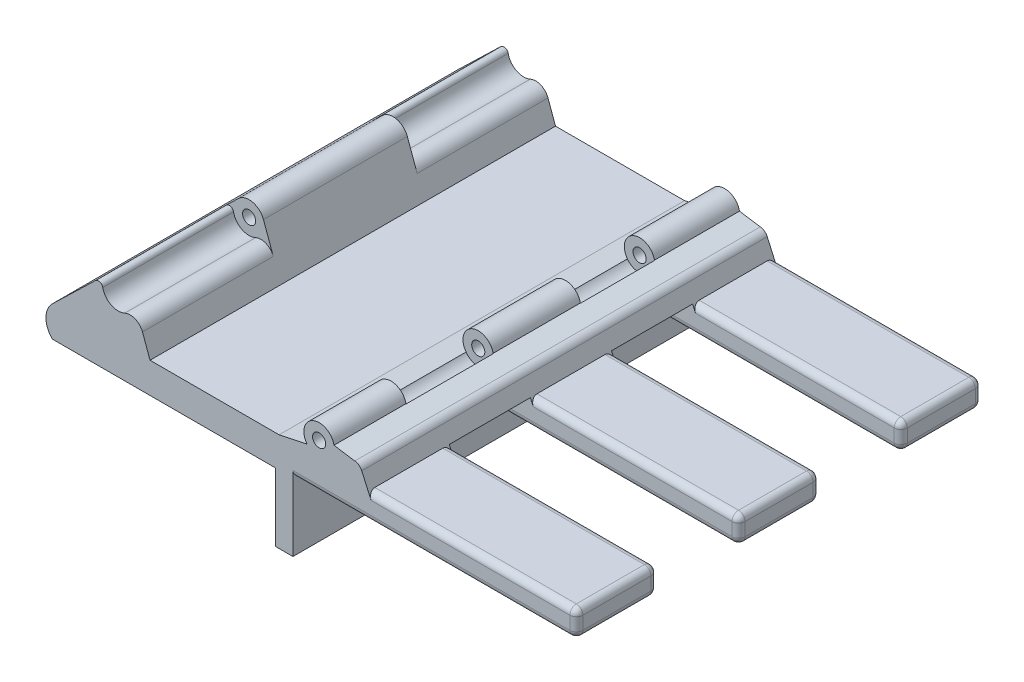
from build123d import *

# Parameters (mm, degrees)
SALIENTE_EXTRUIR2_DEPTH   = 46.5
CROQUIS3_R                = 1.500774296
CROQUIS3_R_2              = 1.503322105
CORTAR_EXTRUIR1_DEPTH     = 46.5
CORTAR_EXTRUIR2_START     = 16.5
CORTAR_EXTRUIR2_OUTLINE_R = 1.500774296
CORTAR_EXTRUIR2_DEPTH     = 30
REDONDEO2_R               = 3
CORTAR_EXTRUIR3_START     = -46.5
CORTAR_EXTRUIR3_OUTLINE_R = 1.500774296
CORTAR_EXTRUIR3_DEPTH     = 30
REDONDEO3_R               = 3
CORTAR_EXTRUIR4_START     = 10
CORTAR_EXTRUIR4_OUTLINE_R = 1.503322105
CORTAR_EXTRUIR4_DEPTH     = 20
CORTAR_EXTRUIR5_START     = -27
CORTAR_EXTRUIR5_OUTLINE_R = 1.503322105
CORTAR_EXTRUIR5_DEPTH     = 17
REDONDEO4_R               = 1
CROQUIS4_W                = 18.6
CROQUIS4_H                = 6
CORTAR_EXTRUIR6_DEPTH     = 133.823646461
CROQUIS5_W                = 18.6
CROQUIS5_H                = 6
CORTAR_EXTRUIR7_DEPTH     = 133.823646461
REDONDEO5_R               = 1.5
REDONDEO6_R               = 2


# Read off the part's stored shape, not the designer's step: Cortar-Extruir2, Cortar-Extruir3, Cortar-Extruir4, Cortar-Extruir5
with BuildPart() as part:
    # Croquis1 → Saliente-Extruir2 (new, symmetric)
    with BuildSketch(Plane.XY):
        with BuildLine():
            Line((-10.68367701, -0.137920216), (-8.740480313, -4.5))
            Line((-8.740480313, -4.5), (39, -4.5))
            Line((39, -4.5), (39, -10.5))
            Line((39, -10.5), (-26, -10.5))
            Line((-26, -10.5), (-26, -26.1))
            Line((-26, -26.1), (-30, -26.1))
            Line((-30, -26.1), (-30, -10.5))
            Line((-30, -10.5), (-81.2, -10.5))
            ThreePointArc((-81.2, -10.5), (-82.649747468, -7), (-81.2, -3.5))
            Line((-81.2, -3.5), (-68.491106331, 8.777732226))
            ThreePointArc((-68.491106331, 8.777732226), (-65.272311444, 9.670901246), (-62.770376094, 7.457598075))
            Line((-62.770376094, 7.457598075), (-58.782136556, -3.5))
            Line((-58.782136556, -3.5), (-29.179236041, -3.5))
            Line((-29.179236041, -3.5), (-22.771154479, -2.137920216))
            ThreePointArc((-22.771154479, -2.137920216), (-21.470497358, 3.176104142), (-16.576957377, 0.729917256))
            ThreePointArc((-16.576957377, 0.729917256), (-13.638551951, 0.240078221), (-10.68367701, -0.137920216))
        make_face()
    extrude(amount=SALIENTE_EXTRUIR2_DEPTH, both=True)

    # Croquis3 → Cortar-Extruir1 (cut, symmetric)
    with BuildSketch(Plane.XY):
        with Locations((-66.059300267, 6.260527573)):
            Circle(CROQUIS3_R)
        with Locations((-20, 0)):
            Circle(CROQUIS3_R_2)
    extrude(amount=CORTAR_EXTRUIR1_DEPTH, both=True, mode=Mode.SUBTRACT)

    # Cortar-Extruir2 outline → Cortar-Extruir2 (cut)
    with BuildSketch(Plane.XY.offset(CORTAR_EXTRUIR2_START)):
        with BuildLine():
            Line((-68.491106331, 8.777732226), (-69.201699105, 8.091246996))
            ThreePointArc((-69.201699105, 8.091246996), (-66.848168988, 2.721235528), (-62.462991688, 6.61306636))
            Line((-62.462991688, 6.61306636), (-62.770376094, 7.457598075))
            ThreePointArc((-62.770376094, 7.457598075), (-65.272311444, 9.670901246), (-68.491106331, 8.777732226))
        make_face()
        with Locations((-66.059300267, 6.260527573)):
            Circle(CORTAR_EXTRUIR2_OUTLINE_R, mode=Mode.SUBTRACT)
    extrude(amount=CORTAR_EXTRUIR2_DEPTH, mode=Mode.SUBTRACT)

    # Redondeo2
    redondeo2_edges = [part.edges().sort_by_distance(p)[0] for p in [
        (-62.462991688, 6.61306636, 31.5),
    ]]
    fillet(redondeo2_edges, radius=REDONDEO2_R)

    # Cortar-Extruir3 outline → Cortar-Extruir3 (cut)
    with BuildSketch(Plane.XY.offset(CORTAR_EXTRUIR3_START)):
        with BuildLine():
            ThreePointArc((-69.164573514, 8.127113066), (-66.827048097, 2.685630168), (-62.508602445, 6.738380883))
            Line((-62.508602445, 6.738380883), (-62.770376094, 7.457598075))
            ThreePointArc((-62.770376094, 7.457598075), (-65.272311444, 9.670901246), (-68.491106331, 8.777732226))
            Line((-68.491106331, 8.777732226), (-69.164573514, 8.127113066))
        make_face()
        with Locations((-66.059300267, 6.260527573)):
            Circle(CORTAR_EXTRUIR3_OUTLINE_R, mode=Mode.SUBTRACT)
    extrude(amount=CORTAR_EXTRUIR3_DEPTH, mode=Mode.SUBTRACT)

    # Redondeo3
    redondeo3_edges = [part.edges().sort_by_distance(p)[0] for p in [
        (-62.508602445, 6.738380883, -31.5),
    ]]
    fillet(redondeo3_edges, radius=REDONDEO3_R)

    # Cortar-Extruir4 outline → Cortar-Extruir4 (cut)
    with BuildSketch(Plane.XY.offset(CORTAR_EXTRUIR4_START)):
        with BuildLine():
            Line((-22.771154479, -2.137920216), (-22.827271519, -2.149848262))
            ThreePointArc((-22.827271519, -2.149848262), (-18.523452571, -3.240720775), (-16.513304708, 0.718087877))
            ThreePointArc((-16.513304708, 0.718087877), (-16.545132262, 0.723996005), (-16.576957377, 0.729917256))
            ThreePointArc((-16.576957377, 0.729917256), (-21.470497358, 3.176104142), (-22.771154479, -2.137920216))
        make_face()
        with Locations((-20, 0)):
            Circle(CORTAR_EXTRUIR4_OUTLINE_R, mode=Mode.SUBTRACT)
    extrude(amount=CORTAR_EXTRUIR4_DEPTH, mode=Mode.SUBTRACT)

    # Cortar-Extruir5 outline → Cortar-Extruir5 (cut)
    with BuildSketch(Plane.XY.offset(CORTAR_EXTRUIR5_START)):
        with BuildLine():
            ThreePointArc((-22.813751372, -2.146974465), (-18.533466696, -3.203987987), (-16.523253553, 0.719933216))
            ThreePointArc((-16.523253553, 0.719933216), (-16.550106333, 0.724920565), (-16.576957377, 0.729917256))
            ThreePointArc((-16.576957377, 0.729917256), (-21.470497358, 3.176104142), (-22.771154479, -2.137920216))
            Line((-22.771154479, -2.137920216), (-22.813751372, -2.146974465))
        make_face()
        with Locations((-20, 0)):
            Circle(CORTAR_EXTRUIR5_OUTLINE_R, mode=Mode.SUBTRACT)
    extrude(amount=CORTAR_EXTRUIR5_DEPTH, mode=Mode.SUBTRACT)

    # Redondeo4
    redondeo4_edges = [part.edges().sort_by_distance(p)[0] for p in [
        (-69.201699105, 8.091246996, 31.5),
        (-69.164573514, 8.127113066, -31.5),
    ]]
    fillet(redondeo4_edges, radius=REDONDEO4_R)

    # Croquis4 → Cortar-Extruir6 (cut, through all)
    with BuildSketch(Plane(origin=(39, 0, 0), x_dir=(0, 0, -1), z_dir=(1, 0, 0))):
        with Locations((18.6, -7.5)):
            Rectangle(CROQUIS4_W, CROQUIS4_H)
    extrude(amount=-CORTAR_EXTRUIR6_DEPTH, mode=Mode.SUBTRACT)

    # Croquis5 → Cortar-Extruir7 (cut, through all)
    with BuildSketch(Plane(origin=(39, 0, 0), x_dir=(0, 0, -1), z_dir=(1, 0, 0))):
        with Locations((-18.6, -7.5)):
            Rectangle(CROQUIS5_W, CROQUIS5_H)
    extrude(amount=-CORTAR_EXTRUIR7_DEPTH, mode=Mode.SUBTRACT)

    # Redondeo5
    redondeo5_edges = [part.edges().sort_by_distance(p)[0] for p in [
        (39, -4.5, -37.2),
        (15.129759844, -4.5, -46.5),
        (39, -10.5, -37.2),
        (39, -7.5, -46.5),
        (6.5, -10.5, -46.5),
        (6.5, -10.5, -27.9),
        (15.129759844, -4.5, -27.9),
        (6.5, -10.5, -9.3),
        (15.129759844, -4.5, -9.3),
        (39, -7.5, -27.9),
        (39, -7.5, -9.3),
        (39, -4.5, 0),
        (39, -10.5, 0),
        (6.5, -10.5, 9.3),
        (15.129759844, -4.5, 9.3),
        (6.5, -10.5, 27.9),
        (15.129759844, -4.5, 27.9),
        (39, -7.5, 9.3),
        (39, -7.5, 27.9),
        (39, -4.5, 37.2),
        (39, -10.5, 37.2),
        (6.5, -10.5, 46.5),
        (39, -7.5, 46.5),
        (15.129759844, -4.5, 46.5),
    ]]
    fillet(redondeo5_edges, radius=REDONDEO5_R)

    # Redondeo6
    redondeo6_edges = [part.edges().sort_by_distance(p)[0] for p in [
        (-10.68367701, -0.137920216, 0),
    ]]
    fillet(redondeo6_edges, radius=REDONDEO6_R)


solid = part.part
